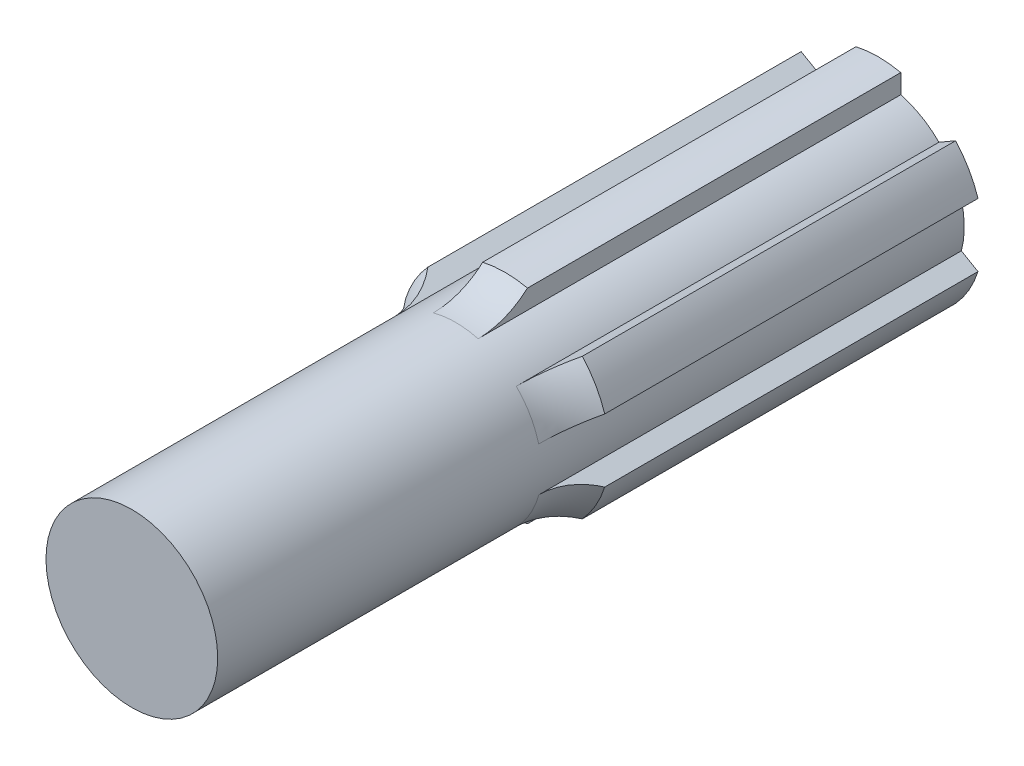
from build123d import *

# Parameters (mm, degrees)
SKETCH1_R           = 11.5
SHAFT_DEPTH         = 50
BOSS_EXTRUDE2_DEPTH = 50
FILLET1_R           = 10
CIRPATTERN1_START   = -50
CIRPATTERN1_DEPTH   = 56.614378378


with BuildPart() as part:
    # Sketch1 → Shaft (new, symmetric)
    with BuildSketch(Plane.XY):
        Circle(SKETCH1_R)
    extrude(amount=SHAFT_DEPTH, both=True)

    # Sketch2 → Boss-Extrude2 (add)
    with BuildSketch(Plane.XY):
        with BuildLine():
            Line((3, 11.101801656), (3, 13.674794331))
            ThreePointArc((3, 13.674794331), (0, 14), (-3, 13.674794331))
            Line((-3, 13.674794331), (-3, 11.101801656))
            ThreePointArc((-3, 11.101801656), (0, 11.5), (3, 11.101801656))
        make_face()
    extrude(amount=-BOSS_EXTRUDE2_DEPTH)

    # Fillet1
    # the kernel refuses this fillet: 10 mm, written as the material it adds along each edge
    with BuildSketch(Plane(origin=(0, 0, 0), x_dir=(-0.9914186895468253, -0.13072483320798547, 0), z_dir=(0.13072483320798547, -0.9914186895468253, 0))) as fillet1_piece_1_section:
        with BuildLine():
            CenterArc((21.5, -6.614378278), FILLET1_R, 138.590377891, 41.409622109)
            Line((14, 0), (13.85, 0.132287566))
            ThreePointArc((13.85, 0.132287566), (12.75, 0.2), (11.5, 0.2))
            Line((11.5, 0.2), (11.3, 0))
            Line((11.3, 0), (11.3, -6.614378278))
            Line((11.3, -6.614378278), (11.5, -6.614378278))
        make_face()
    fillet1_piece_1 = revolve(axis=Axis((0, 0, 0), (0, 0, -1)), revolution_arc=195.022959301, mode=Mode.PRIVATE)
    fillet1_piece_1 = split(fillet1_piece_1, bisect_by=Plane(origin=(-3, 0, 0), z_dir=(1, 0, 0)), keep=Keep.TOP, mode=Mode.PRIVATE)
    fillet1_piece_1 = split(fillet1_piece_1, bisect_by=Plane(origin=(3, 0, 0), z_dir=(-1, 0, 0)), keep=Keep.TOP, mode=Mode.PRIVATE)
    add(fillet1_piece_1)

    # CirPattern1: read off the stored shape, not the designer's step
    # CirPattern1 outline → CirPattern1 (add)
    with BuildSketch(Plane.XY.offset(CIRPATTERN1_START)):
        with BuildLine():
            Line((11.114442262, 2.952824616), (13.342719282, 4.239320954))
            ThreePointArc((13.342719282, 4.239320954), (12.124355653, 7), (10.342719282, 9.435473377))
            Line((10.342719282, 9.435473377), (8.114442262, 8.148977039))
            ThreePointArc((8.114442262, 8.148977039), (9.959292144, 5.75), (11.114442262, 2.952824616))
        make_face()
        with BuildLine():
            ThreePointArc((-11.114442262, 2.952824616), (-9.959292144, 5.75), (-8.114442262, 8.148977039))
            Line((-8.114442262, 8.148977039), (-10.342719282, 9.435473377))
            ThreePointArc((-10.342719282, 9.435473377), (-12.124355653, 7), (-13.342719282, 4.239320954))
            Line((-13.342719282, 4.239320954), (-11.114442262, 2.952824616))
        make_face()
        with BuildLine():
            Line((13.342719282, -4.239320954), (11.114442262, -2.952824616))
            ThreePointArc((11.114442262, -2.952824616), (9.959292144, -5.75), (8.114442262, -8.148977039))
            Line((8.114442262, -8.148977039), (10.342719282, -9.435473377))
            ThreePointArc((10.342719282, -9.435473377), (12.124355653, -7), (13.342719282, -4.239320954))
        make_face()
        with BuildLine():
            ThreePointArc((-8.114442262, -8.148977039), (-9.959292144, -5.75), (-11.114442262, -2.952824616))
            Line((-11.114442262, -2.952824616), (-13.342719282, -4.239320954))
            ThreePointArc((-13.342719282, -4.239320954), (-12.124355653, -7), (-10.342719282, -9.435473377))
            Line((-10.342719282, -9.435473377), (-8.114442262, -8.148977039))
        make_face()
        with BuildLine():
            Line((3, -13.674794331), (3, -11.101801656))
            ThreePointArc((3, -11.101801656), (0, -11.5), (-3, -11.101801656))
            Line((-3, -11.101801656), (-3, -13.674794331))
            ThreePointArc((-3, -13.674794331), (0, -14), (3, -13.674794331))
        make_face()
    extrude(amount=CIRPATTERN1_DEPTH)

    # CirPattern1 2 outline → CirPattern1 2 (revolve, cut)
    with BuildSketch(Plane.XZ):
        with BuildLine():
            ThreePointArc((11.5, 6.614378278), (12.145856533, 3.078844372), (14, 0))
            Line((14, 0), (14, 6.614378378))
            Line((14, 6.614378378), (11.5, 6.614378278))
        make_face()
    revolve(axis=Axis((0, 0, 0), (0, 0, 1)), mode=Mode.SUBTRACT)


solid = part.part
